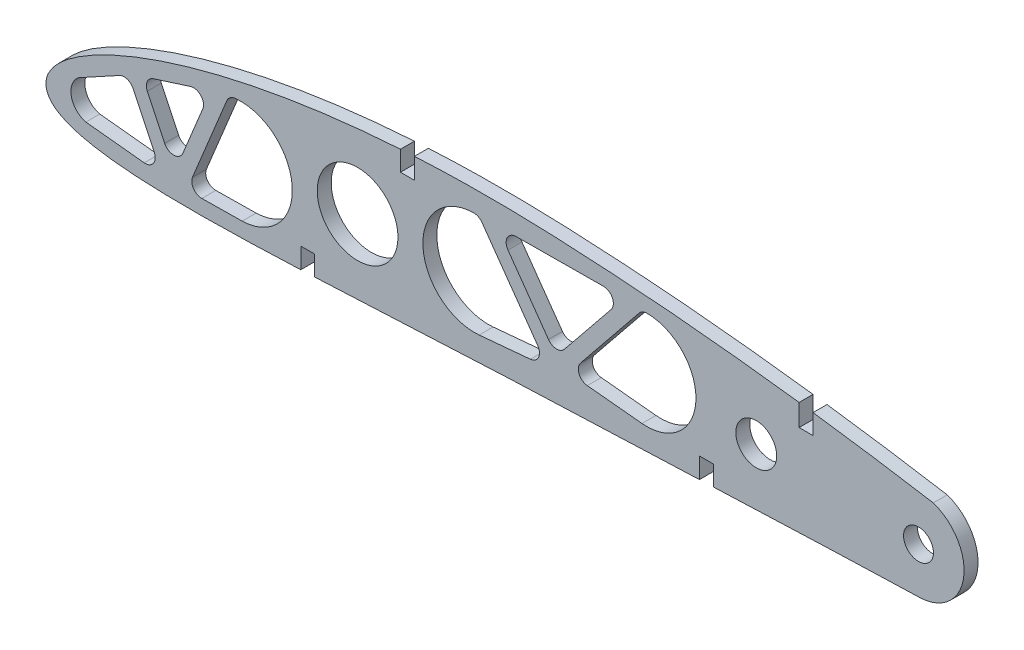
from build123d import *

# Parameters (mm, degrees)
SKETCH_2_R      = 3
SKETCH_2_R_2    = 8.1
SKETCH_2_R_3    = 4.1
EXTRUDE_2_DEPTH = 1.4


with BuildPart() as part:
    # Эскиз2 → Бобышка-Вытянуть2 (new, symmetric)
    with BuildSketch(Plane.XY):
        with BuildLine():
            Line((153.932619318, 19.787470759), (153.932619318, 15.787470759))
            Line((153.932619318, 15.787470759), (151.132619318, 15.787470759))
            Line((151.132619318, 15.787470759), (151.132619318, 20.152925753))
            add(Edge.make_bspline(
                [(151.132619318, 20.152925753), (149.51271539, 20.360855756), (145.712882211, 20.834305053), (139.731359791, 21.525676112), (133.19183673, 22.212004248), (126.658683026, 22.825721427), (120.136770918, 23.363973264), (113.62856714, 23.824677322), (107.152732037, 24.200242592), (100.741095693, 24.498399508), (94.411752715, 24.686649766), (88.155917993, 24.740095648), (81.949043055, 24.658849141), (77.212383792, 24.491578654), (74.545027167, 24.35694527), (73.932619318, 24.323871534)],
                knots=[0.390637302, 0.390637302, 0.390637302, 0.390637302, 0.409602822, 0.435103874, 0.460559416, 0.485959195, 0.51130307, 0.536551515, 0.561723366, 0.586628867, 0.611085431, 0.6352512, 0.659272176, 0.683163753, 0.690285585, 0.690285585, 0.690285585, 0.690285585], degree=3))
            Line((73.932619318, 24.323871534), (73.932619318, 20.157469486))
            Line((73.932619318, 20.157469486), (71.132619318, 20.157469486))
            Line((71.132619318, 20.157469486), (71.132619318, 24.157469486))
            add(Edge.make_bspline(
                [(71.132619318, 24.157469486), (70.635982629, 24.125241372), (68.110579653, 23.953963558), (63.575410502, 23.578006358), (57.555189551, 22.924946655), (51.605762689, 22.119065518), (45.744400312, 21.156564429), (39.995857594, 20.035371386), (34.397919843, 18.75631623), (29.010382104, 17.327615604), (23.925798409, 15.771864917), (19.27067884, 14.13426943), (15.179098392, 12.483335433), (11.740475791, 10.89561099), (8.959371869, 9.429577361), (6.760891181, 8.108603195), (5.033709749, 6.92463805), (3.671694934, 5.85422966), (2.592101124, 4.871305364), (1.738175669, 3.952595739), (1.069870831, 3.080946369), (0.571645411, 2.241622098), (0.2157739, 1.430785392), (0.102255582, 0.88324169), (0.047975001, 0.621424995)],
                knots=[0.701142916, 0.701142916, 0.701142916, 0.701142916, 0.706922144, 0.73053591, 0.7539832, 0.77723469, 0.800246382, 0.822950709, 0.845237155, 0.866915896, 0.887662335, 0.906968281, 0.924203157, 0.938878975, 0.950931611, 0.960693484, 0.968646729, 0.975232933, 0.980794744, 0.985583761, 0.989781539, 0.993521313, 0.996902113, 1, 1, 1, 1], degree=3))
            add(Edge.make_bspline(
                [(0.047975001, 0.621424995), (0.022713821, 0.373490081), (-0.027820788, -0.12249998), (0.077991213, -0.884434595), (0.349695651, -1.638838075), (0.814331136, -2.365068928), (1.463480781, -3.039275249), (2.290973018, -3.660999474), (3.305928751, -4.235779626), (4.53525562, -4.773674148), (6.029745689, -5.282192169), (7.868981216, -5.765316681), (10.168831393, -6.221716597), (13.07543819, -6.639618735), (16.728115364, -6.992956742), (21.189952097, -7.247345149), (26.399984417, -7.376638853), (32.197398565, -7.376256917), (38.39780676, -7.261436583), (44.752137938, -7.05998551), (49.023344092, -6.886827907), (51.132619318, -6.795360627)],
                knots=[0, 0, 0, 0, 0.002941446, 0.005884319, 0.00901613, 0.012364547, 0.016007934, 0.020036845, 0.024573728, 0.029783835, 0.03589701, 0.04324044, 0.052275965, 0.063634589, 0.077983176, 0.095698161, 0.116520086, 0.13966073, 0.16431217, 0.18991889, 0.214908072, 0.214908072, 0.214908072, 0.214908072], degree=3))
            Line((51.132619318, -6.795360627), (51.132619318, -2.670677263))
            Line((51.132619318, -2.670677263), (53.932619318, -2.670677263))
            Line((53.932619318, -2.670677263), (53.932619318, -6.670677263))
            add(Edge.make_bspline(
                [(53.932619318, -6.670677263), (55.356569482, -6.605720394), (59.058679651, -6.431131786), (65.052094606, -6.13285227), (71.91077271, -5.784005184), (78.771375577, -5.439680462), (85.61049861, -5.110951262), (92.43210759, -4.804953337), (99.255031191, -4.531981668), (106.097378406, -4.278274685), (112.969211681, -4.003089942), (119.864404255, -3.723176202), (125.92308308, -3.47492717), (129.679854903, -3.321735217), (131.132619318, -3.262735091)],
                knots=[0.225966113, 0.225966113, 0.225966113, 0.225966113, 0.242837762, 0.269833583, 0.296993022, 0.324123272, 0.351139107, 0.378035509, 0.404946016, 0.431960837, 0.459078395, 0.4863474, 0.51364083, 0.530850189, 0.530850189, 0.530850189, 0.530850189], degree=3))
            Line((131.132619318, -3.262735091), (131.132619318, 0.850647814))
            Line((131.132619318, 0.850647814), (133.932619318, 0.850647814))
            Line((133.932619318, 0.850647814), (133.932619318, -3.149352186))
            add(Edge.make_bspline(
                [(133.932619318, -3.149352186), (136.150252366, -3.05984138), (140.66441482, -2.879164577), (147.472013762, -2.613922958), (154.352602411, -2.355626415), (161.225044134, -2.109369921), (168.090869746, -1.876634074), (172.898180613, -1.723887413), (175.416987789, -1.647013923), (175.648957912, -1.639961136)],
                knots=[0.541906346, 0.541906346, 0.541906346, 0.541906346, 0.568176028, 0.595379569, 0.622543445, 0.64967326, 0.676775201, 0.703855228, 0.706602137, 0.706602137, 0.706602137, 0.706602137], degree=3))
            ThreePointArc((175.648957912, -1.639961136), (184.159890845, 6.269234419), (178.051789748, 16.152677882))
            add(Edge.make_bspline(
                [(178.051789748, 16.152677882), (176.186975728, 16.466641576), (172.142894745, 17.131243558), (165.914317088, 18.099827809), (159.739714866, 19.000386852), (155.744292591, 19.547112651), (153.932619318, 19.787470759)],
                knots=[0.285286421, 0.285286421, 0.285286421, 0.285286421, 0.30724642, 0.332878042, 0.358484538, 0.379707003, 0.379707003, 0.379707003, 0.379707003], degree=3))
        make_face()
        with Locations((175.091334091, 7.493910357)):
            Circle(SKETCH_2_R, mode=Mode.SUBTRACT)
        with BuildLine():
            ThreePointArc((92.710261403, 17.428221559), (92.562400415, 19.496921566), (94.32837603, 20.584447529))
            Line((94.32837603, 20.584447529), (111.84428559, 20.7050059))
            ThreePointArc((111.84428559, 20.7050059), (113.659822033, 19.573166514), (113.413576859, 17.447937989))
            Line((113.413576859, 17.447937989), (104.034940499, 5.843025535))
            ThreePointArc((104.034940499, 5.843025535), (102.41617089, 5.101141005), (100.847534604, 5.943867476))
            Line((100.847534604, 5.943867476), (92.710261403, 17.428221559))
        make_face(mode=Mode.SUBTRACT)
        with BuildLine():
            ThreePointArc((14.721240391, 8.766081587), (16.29867531, 8.913940332), (17.488708089, 7.868002897))
            Line((17.488708089, 7.868002897), (21.725441093, -1.073266618))
            ThreePointArc((21.725441093, -1.073266618), (21.549996986, -3.085882804), (19.709418924, -3.918755509))
            Line((19.709418924, -3.918755509), (7.999391348, -2.690370853))
            ThreePointArc((7.999391348, -2.690370853), (5.078852056, 0.362162442), (6.580135706, 4.311042875))
            Line((6.580135706, 4.311042875), (14.721240391, 8.766081587))
        make_face(mode=Mode.SUBTRACT)
        with BuildLine():
            Line((23.813024955, 1.527110532), (20.342244628, 8.85190119))
            ThreePointArc((20.342244628, 8.85190119), (20.315234657, 10.50521233), (21.542097769, 11.613803404))
            Line((21.542097769, 11.613803404), (29.003823035, 13.992759157))
            ThreePointArc((29.003823035, 13.992759157), (31.082028751, 13.44264333), (31.461008962, 11.326528867))
            Line((31.461008962, 11.326528867), (27.470064023, 1.622782457))
            ThreePointArc((27.470064023, 1.622782457), (25.672695714, 0.384197539), (23.813024955, 1.527110532))
        make_face(mode=Mode.SUBTRACT)
        with BuildLine():
            ThreePointArc((31.277857225, -4.328453595), (29.59717908, -3.452864074), (29.401621993, -1.567898965))
            Line((29.401621993, -1.567898965), (36.28872379, 15.177681436))
            ThreePointArc((36.28872379, 15.177681436), (36.93262885, 16.01260855), (37.911651949, 16.404055587))
            ThreePointArc((37.911651949, 16.404055587), (49.40696202, 6.85120019), (39.366777065, -4.221012142))
            Line((39.366777065, -4.221012142), (31.277857225, -4.328453595))
        make_face(mode=Mode.SUBTRACT)
        with Locations((62.532619318, 8.596197208)):
            Circle(SKETCH_2_R_2, mode=Mode.SUBTRACT)
        with Locations((142.532619318, 8.596197208)):
            Circle(SKETCH_2_R_3, mode=Mode.SUBTRACT)
        with BuildLine():
            ThreePointArc((85.834710285, 20.440331448), (86.770100886, 20.22407123), (87.496942629, 19.59683512))
            Line((87.496942629, 19.59683512), (98.656957359, 3.846404038))
            ThreePointArc((98.656957359, 3.846404038), (98.841412786, 1.852917443), (97.205894504, 0.698321168))
            Line((97.205894504, 0.698321168), (86.928494978, -0.234664059))
            ThreePointArc((86.928494978, -0.234664059), (75.647085804, 9.534937552), (85.834710285, 20.440331448))
        make_face(mode=Mode.SUBTRACT)
        with BuildLine():
            ThreePointArc((108.623842739, 1.821697682), (106.976814232, 3.040567769), (107.26658781, 5.068960843))
            Line((107.26658781, 5.068960843), (119.042711354, 19.640469699))
            ThreePointArc((119.042711354, 19.640469699), (119.738361249, 20.189071191), (120.602738696, 20.383349351))
            ThreePointArc((120.602738696, 20.383349351), (130.419922424, 10.031300237), (119.603876283, 0.727797506))
            Line((119.603876283, 0.727797506), (108.623842739, 1.821697682))
        make_face(mode=Mode.SUBTRACT)
    extrude(amount=EXTRUDE_2_DEPTH, both=True)


solid = part.part
